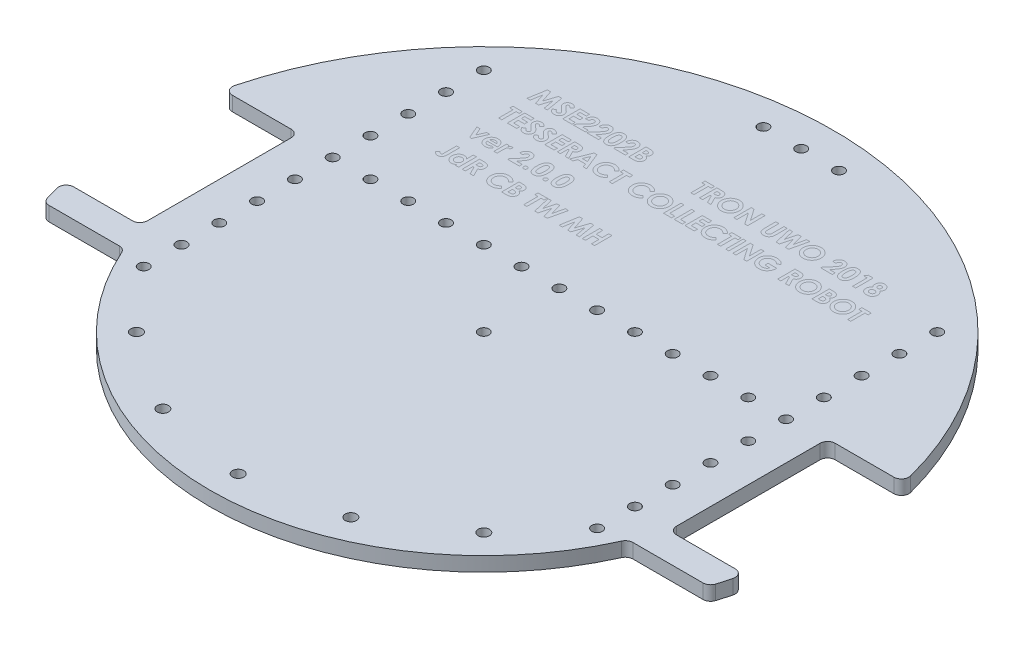
from build123d import *

# Parameters (mm, degrees)
SKETCH1_R            = 117.475
BOSS_EXTRUDE1_DEPTH  = 4.826
CUT_EXTRUDE4_DEPTH   = 167.204817999
FILLET1_R            = 2.54
FILLET1_OF_MIRROR1_R = 2.54
SKETCH4_R            = 1.778
CUT_EXTRUDE5_DEPTH   = 164.559307064
SKETCH5_R            = 1.778
CUT_EXTRUDE6_DEPTH   = 164.559307064
SKETCH6_R            = 1.778
CUT_EXTRUDE7_DEPTH   = 164.559307064
SKETCH9_R            = 1.905
CUT_EXTRUDE10_DEPTH  = 164.559307064
CIRPATTERN1_COUNT    = 3
CIRPATTERN1_ANGLE    = 45
CIRPATTERN2_COUNT    = 3
CIRPATTERN2_ANGLE    = 45


with BuildPart() as part:
    # Sketch1 → Boss-Extrude1 (new body)
    with BuildSketch(Plane(origin=(0, 0, 0), x_dir=(1, 0, 0), z_dir=(0, 1, 0))):
        Circle(SKETCH1_R)
    extrude(amount=-BOSS_EXTRUDE1_DEPTH)

    # Sketch3 → Cut-Extrude4 (cut, through all)
    with BuildSketch(Plane(origin=(0, 0, 0), x_dir=(1, 0, 0), z_dir=(0, 1, 0))):
        with BuildLine():
            Line((-114.407546626, 26.67), (-88.9, 26.67))
            Line((-88.9, 26.67), (-88.9, -26.67))
            Line((-88.9, -26.67), (-114.407546626, -26.67))
            ThreePointArc((-114.407546626, -26.67), (-117.475, 0), (-114.407546626, 26.67))
        make_face()
        with BuildLine():
            Line((0, -92.075), (0, -117.475))
            ThreePointArc((0, -117.475), (-69.095470184, -95.006271504), (-111.76, -36.195))
            Line((-111.76, -36.195), (-84.662433227, -36.195))
            ThreePointArc((-84.662433227, -36.195), (-50.720562891, -76.845495151), (0, -92.075))
        make_face()
    cut_extrude4 = extrude(amount=-CUT_EXTRUDE4_DEPTH, mode=Mode.SUBTRACT)

    # Fillet1
    fillet1_edges = [part.edges().sort_by_distance(p)[0] for p in [
        (-114.407546626, -2.413, 26.67),
        (-114.407546626, -2.413, -26.67),
        (-88.9, -2.413, 26.67),
        (-88.9, -2.413, -26.67),
        (-111.76, -2.413, 36.195),
        (-84.662433227, -2.413, 36.195),
    ]]
    fillet(fillet1_edges, radius=FILLET1_R)

    # Mirror1: Cut-Extrude4 across plane
    add(cut_extrude4.mirror(Plane(origin=(0, 0, 0), x_dir=(0, 0, 1), z_dir=(1, 0, 0))), mode=Mode.SUBTRACT)

    # Fillet1 of Mirror1
    fillet1_of_mirror1_edges = [part.edges().sort_by_distance(p)[0] for p in [
        (114.407546626, -2.413, 26.67),
        (114.407546626, -2.413, -26.67),
        (88.9, -2.413, 26.67),
        (88.9, -2.413, -26.67),
        (111.76, -2.413, 36.195),
        (84.662433227, -2.413, 36.195),
    ]]
    fillet(fillet1_of_mirror1_edges, radius=FILLET1_OF_MIRROR1_R)

    # Sketch4 → Cut-Extrude5 (cut, through all)
    with BuildSketch(Plane(origin=(0, 0, 0), x_dir=(1, 0, 0), z_dir=(0, 1, 0))):
        with Locations((-76.2, 0)):
            Circle(SKETCH4_R)
        with Locations((-76.2, 12.7)):
            Circle(SKETCH4_R)
        with Locations((-76.2, 25.4)):
            Circle(SKETCH4_R)
        with Locations((-76.2, 38.1)):
            Circle(SKETCH4_R)
        with Locations((-76.2, -12.7)):
            Circle(SKETCH4_R)
        with Locations((-76.2, -25.4)):
            Circle(SKETCH4_R)
        with Locations((-76.2, -38.1)):
            Circle(SKETCH4_R)
        with Locations((-76.2, 50.8)):
            Circle(SKETCH4_R)
        with Locations((-76.2, 63.5)):
            Circle(SKETCH4_R)
        with Locations((-76.2, 76.2)):
            Circle(SKETCH4_R)
    cut_extrude5 = extrude(amount=-CUT_EXTRUDE5_DEPTH, mode=Mode.SUBTRACT)

    # Sketch5 → Cut-Extrude6 (cut, through all)
    with BuildSketch(Plane(origin=(0, 0, 0), x_dir=(1, 0, 0), z_dir=(0, 1, 0))):
        Circle(SKETCH5_R)
    extrude(amount=-CUT_EXTRUDE6_DEPTH, mode=Mode.SUBTRACT)

    # Sketch6 → Cut-Extrude7 (cut, through all)
    with BuildSketch(Plane(origin=(0, 0, 0), x_dir=(1, 0, 0), z_dir=(0, 1, 0))):
        with Locations((0, 25.4)):
            Circle(SKETCH6_R)
        with Locations((-12.7, 25.4)):
            Circle(SKETCH6_R)
        with Locations((-25.4, 25.4)):
            Circle(SKETCH6_R)
        with Locations((-38.1, 25.4)):
            Circle(SKETCH6_R)
        with Locations((12.7, 25.4)):
            Circle(SKETCH6_R)
        with Locations((25.4, 25.4)):
            Circle(SKETCH6_R)
        with Locations((38.1, 25.4)):
            Circle(SKETCH6_R)
        with Locations((-50.8, 25.4)):
            Circle(SKETCH6_R)
        with Locations((50.8, 25.4)):
            Circle(SKETCH6_R)
        with Locations((-63.5, 25.4)):
            Circle(SKETCH6_R)
        with Locations((63.5, 25.4)):
            Circle(SKETCH6_R)
        with Locations((0, 106.68)):
            Circle(SKETCH6_R)
        with Locations((-12.7, 106.68)):
            Circle(SKETCH6_R)
        with Locations((12.7, 106.68)):
            Circle(SKETCH6_R)
    extrude(amount=-CUT_EXTRUDE7_DEPTH, mode=Mode.SUBTRACT)

    # Mirror3: Cut-Extrude5 across plane
    add(cut_extrude5.mirror(Plane(origin=(0, 0, 0), x_dir=(0, 0, 1), z_dir=(1, 0, 0))), mode=Mode.SUBTRACT)

    # Sketch9 → Cut-Extrude10 (cut, through all)
    with BuildSketch(Plane(origin=(0, 0, 0), x_dir=(1, 0, 0), z_dir=(0, 1, 0))):
        with Locations((0, -82.55)):
            Circle(SKETCH9_R)
    cut_extrude10 = extrude(amount=-CUT_EXTRUDE10_DEPTH, mode=Mode.SUBTRACT)

    # CirPattern1: Cut-Extrude10 ×3 about axis
    cirpattern1_axis = Axis((0, -4.826, 0), (0, 1, 0))
    for i in range(1, CIRPATTERN1_COUNT):
        add(cut_extrude10.rotate(cirpattern1_axis, i * CIRPATTERN1_ANGLE / (CIRPATTERN1_COUNT - 1)), mode=Mode.SUBTRACT)

    # CirPattern2: Cut-Extrude10 ×3 about axis
    cirpattern2_axis = Axis((0, -4.826, 0), (0, -1, 0))
    for i in range(1, CIRPATTERN2_COUNT):
        add(cut_extrude10.rotate(cirpattern2_axis, i * CIRPATTERN2_ANGLE / (CIRPATTERN2_COUNT - 1)), mode=Mode.SUBTRACT)


solid = part.part
